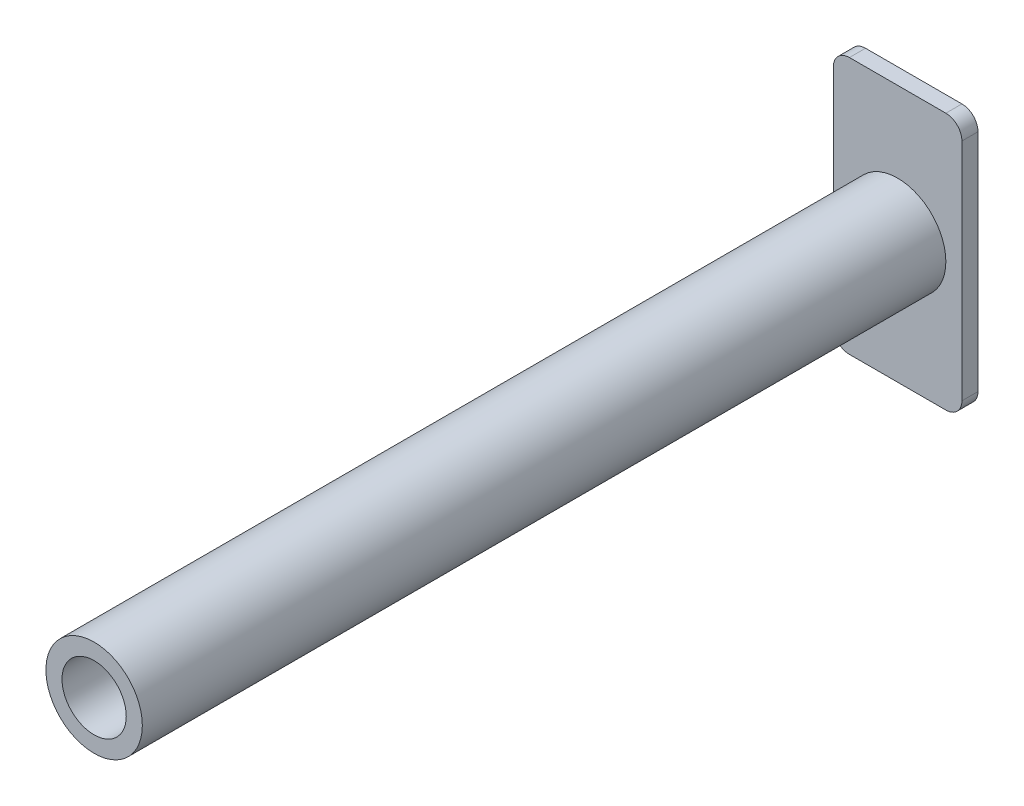
from build123d import *

# Parameters (mm, degrees)
PLATE_SKETCH_W      = 80
PLATE_SKETCH_H      = 160
PLATE_EXTRUDE_DEPTH = 10
PLATE_FILLET_R      = 10
POLE_SKETCH_R       = 30
POLE_SKETCH_R_2     = 20
POLE_EXTRUDE_DEPTH  = 500


with BuildPart() as part:
    # Plate Sketch → Plate Extrude (new body)
    with BuildSketch(Plane.XY):
        Rectangle(PLATE_SKETCH_W, PLATE_SKETCH_H)
    extrude(amount=PLATE_EXTRUDE_DEPTH)

    # Plate Fillet
    plate_fillet_edges = [part.edges().sort_by_distance(p)[0] for p in [
        (40, -80, 5),
        (-40, -80, 5),
        (-40, 80, 5),
        (40, 80, 5),
    ]]
    fillet(plate_fillet_edges, radius=PLATE_FILLET_R)

    # Pole Sketch → Pole Extrude (add)
    with BuildSketch(Plane.XY.offset(10)):
        Circle(POLE_SKETCH_R)
        Circle(POLE_SKETCH_R_2, mode=Mode.SUBTRACT)
    extrude(amount=POLE_EXTRUDE_DEPTH)


solid = part.part
